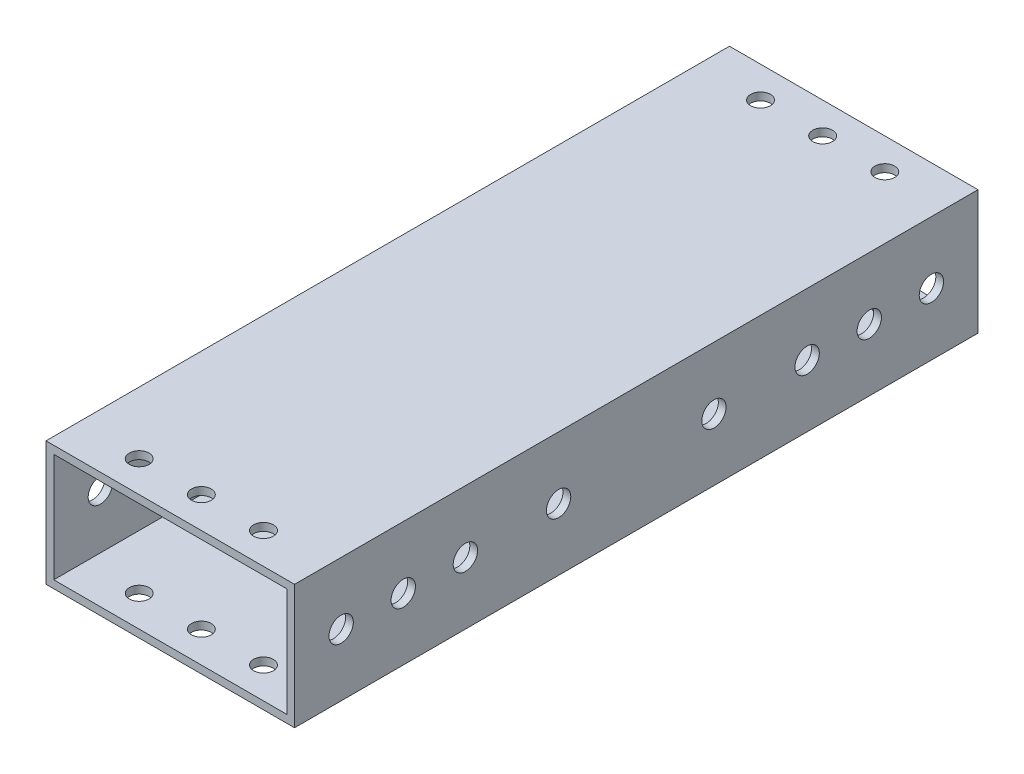
from build123d import *

# Parameters (mm, degrees)
SKETCH1_W           = 50.8
SKETCH1_H           = 25.4
SKETCH1_W_2         = 47.625
SKETCH1_H_2         = 22.225
BOSS_EXTRUDE1_DEPTH = 69.85
SKETCH2_R           = 2.0193
CUT_EXTRUDE1_DEPTH  = 79.545162168
SKETCH3_R           = 2.4892
CUT_EXTRUDE2_DEPTH  = 88.298066989


with BuildPart() as part:
    # Sketch1 → Boss-Extrude1 (new, symmetric)
    with BuildSketch(Plane.XY):
        Rectangle(SKETCH1_W, SKETCH1_H)
        Rectangle(SKETCH1_W_2, SKETCH1_H_2, mode=Mode.SUBTRACT)
    extrude(amount=BOSS_EXTRUDE1_DEPTH, both=True)

    # Sketch2 → Cut-Extrude1 (cut, through all)
    with BuildSketch(Plane(origin=(0, 12.7, 0), x_dir=(1, 0, 0), z_dir=(0, 1, 0))):
        with Locations((-12.7, 63.5)):
            Circle(SKETCH2_R)
        with Locations((0, 63.5)):
            Circle(SKETCH2_R)
        with Locations((12.7, 63.5)):
            Circle(SKETCH2_R)
        with Locations((12.7, -63.5)):
            Circle(SKETCH2_R)
        with Locations((0, -63.5)):
            Circle(SKETCH2_R)
        with Locations((-12.7, -63.5)):
            Circle(SKETCH2_R)
    extrude(amount=-CUT_EXTRUDE1_DEPTH, mode=Mode.SUBTRACT)

    # Sketch3 → Cut-Extrude2 (cut, through all)
    with BuildSketch(Plane(origin=(25.4, 0, 0), x_dir=(0, 0, -1), z_dir=(1, 0, 0))):
        with Locations((-60.325, 0)):
            Circle(SKETCH3_R)
        with Locations((60.325, 0)):
            Circle(SKETCH3_R)
        with Locations((-47.625, 0)):
            Circle(SKETCH3_R)
        with Locations((-34.925, 0)):
            Circle(SKETCH3_R)
        with Locations((34.925, 0)):
            Circle(SKETCH3_R)
        with Locations((47.625, 0)):
            Circle(SKETCH3_R)
        with Locations((-15.875, 0)):
            Circle(SKETCH3_R)
        with Locations((15.875, 0)):
            Circle(SKETCH3_R)
    extrude(amount=-CUT_EXTRUDE2_DEPTH, mode=Mode.SUBTRACT)


solid = part.part
